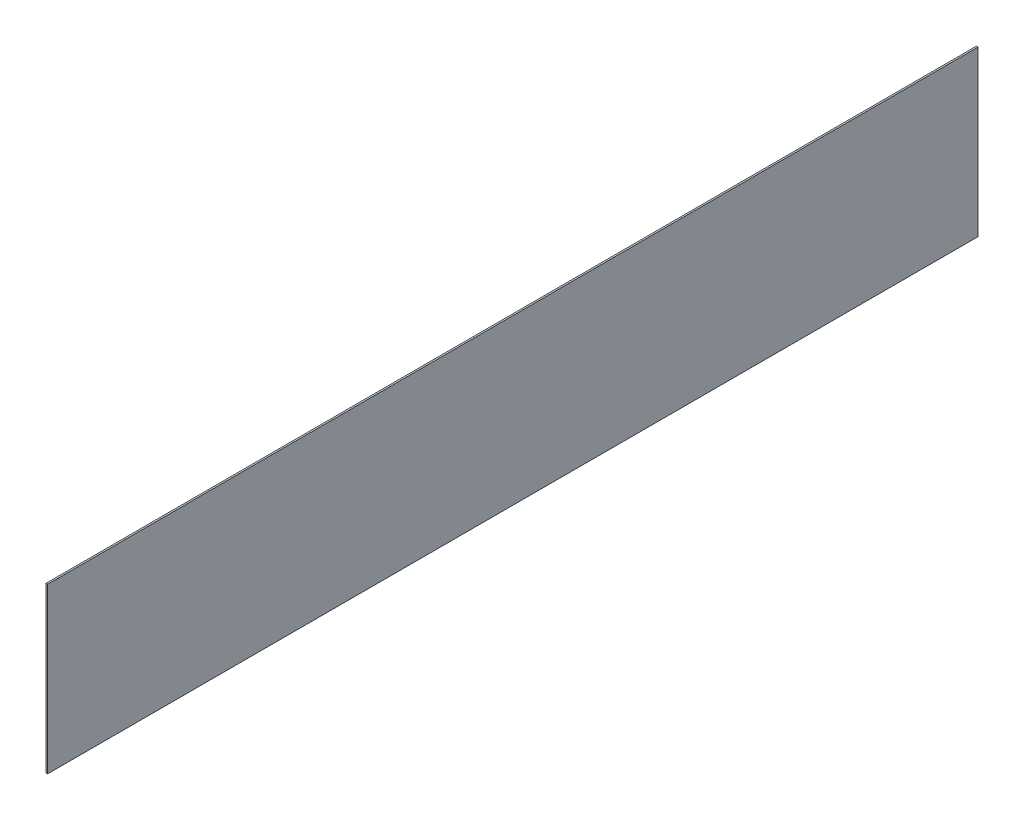
from build123d import *

# Parameters (mm, degrees)
ESBO_O1_W          = 1.2
ESBO_O1_H          = 120
FLANGE_BASE1_DEPTH = 680


# Sheet-metal steps are written as plain solids
with BuildPart() as part:
    # Esboço1 → Flange-base1 (new body)
    with BuildSketch(Plane.XY):
        with Locations((0.6, 60)):
            Rectangle(ESBO_O1_W, ESBO_O1_H)
    extrude(amount=FLANGE_BASE1_DEPTH)


solid = part.part
